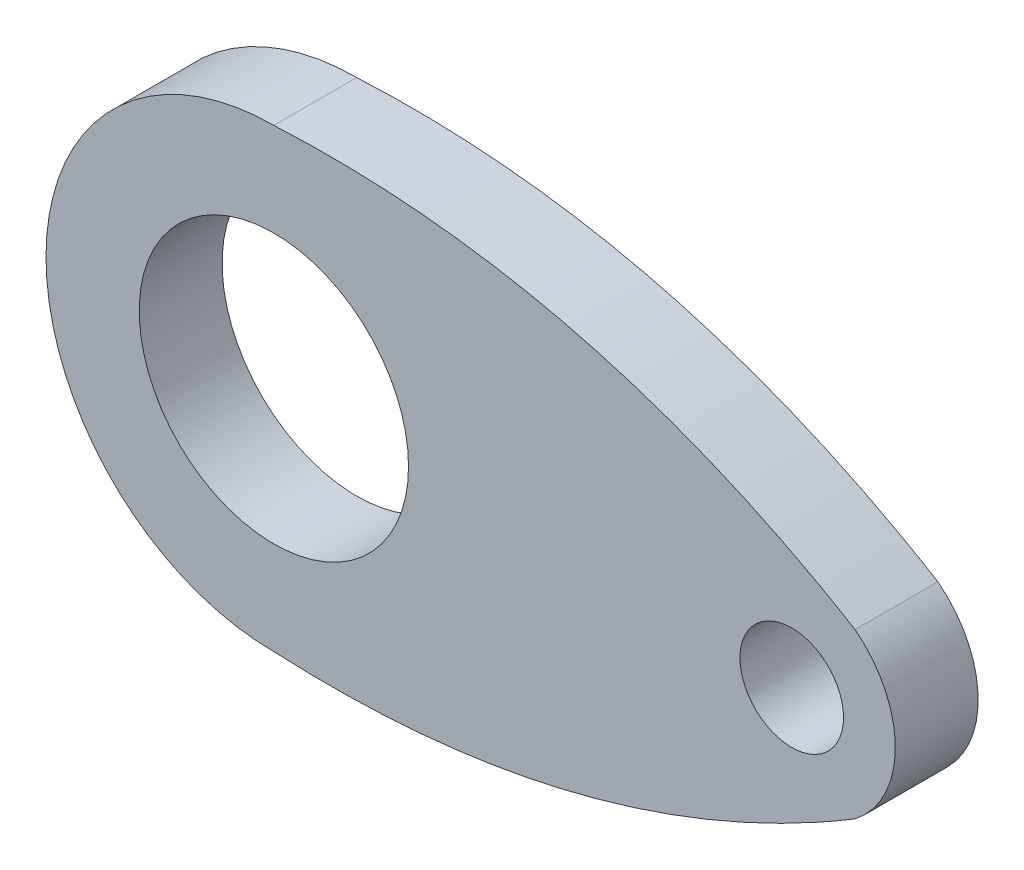
from build123d import *

# Parameters (mm, degrees)
ESQUISSE1_R             = 11
BOSS_EXTRU_2_DEPTH      = 4
BOSS_EXTRU_3_DEPTH      = 4
ESQUISSE6_R             = 6.5
ENL_V_MAT_EXTRU_1_DEPTH = 4
ESQUISSE7_R             = 2.5
ENL_V_MAT_EXTRU_2_DEPTH = 4
EPAISSIR3_DEPTH         = 4


# Read off the part's stored shape, not the designer's step: Boss.-Extru.3, Epaissir3
with BuildPart() as part:
    # Esquisse1 → Boss.-Extru.2 (new body)
    with BuildSketch(Plane.XY):
        Circle(ESQUISSE1_R)
    extrude(amount=BOSS_EXTRU_2_DEPTH)

    # Esquisse6 → Enlèv. mat.-Extru.1 (cut)
    with BuildSketch(Plane.XY.offset(4)):
        Circle(ESQUISSE6_R)
    extrude(amount=-ENL_V_MAT_EXTRU_1_DEPTH, mode=Mode.SUBTRACT)



with BuildPart() as body_2:
    # Boss.-Extru.3 outline → Boss.-Extru.3 (new body)
    with BuildSketch(Plane.XY):
        with BuildLine():
            ThreePointArc((26.975217648, 4.586105757), (19.99999917, -0.005763433), (26.972567207, -4.601656213))
            add(Edge.make_bspline(
                [(26.972567207, -4.601656213), (27.515164642, -4.291363801), (28.053929341, -3.966183827)],
                knots=[0.958322196, 0.958322196, 0.958322196, 1, 1, 1], degree=2))
            ThreePointArc((28.053929341, -3.966183827), (29.999998754, -0.008646725), (28.056210795, 3.95001155))
            add(Edge.make_bspline(
                [(26.975217648, 4.586105757), (27.517634871, 4.275501294), (28.056210795, 3.95001155)],
                knots=[0.958322291, 0.958322291, 0.958322291, 1, 1, 1], degree=2))
        make_face()
    extrude(amount=BOSS_EXTRU_3_DEPTH)

    # Esquisse7 → Enlèv. mat.-Extru.2 (cut)
    with BuildSketch(Plane.XY.offset(4)):
        with Locations((24.999998962, -0.007205809)):
            Circle(ESQUISSE7_R)
    extrude(amount=-ENL_V_MAT_EXTRU_2_DEPTH, mode=Mode.SUBTRACT)


with BuildPart() as part_1:
    add(part.part)

    add(body_2.part)  # Epaissir3 merges body 2
    # Epaissir3 outline → Epaissir3 (add)
    with BuildSketch(Plane.XY):
        with BuildLine():
            add(Edge.make_bspline(
                [(0, 11), (14.503070624, 11.728033327), (26.975217648, 4.586105757)],
                knots=[0, 0, 0, 0.958322291, 0.958322291, 0.958322291], degree=2))
            ThreePointArc((0, 11), (10.999999543, -0.003170596), (-0.006341192, -10.999998172))
            add(Edge.make_bspline(
                [(-0.006341192, -10.999998172), (14.496306132, -11.736391644), (26.972567207, -4.601656213)],
                knots=[0, 0, 0, 0.958322196, 0.958322196, 0.958322196], degree=2))
            ThreePointArc((26.972567207, -4.601656213), (19.99999917, -0.005763433), (26.975217648, 4.586105757))
        make_face()
    extrude(amount=EPAISSIR3_DEPTH)


solid = part_1.part
